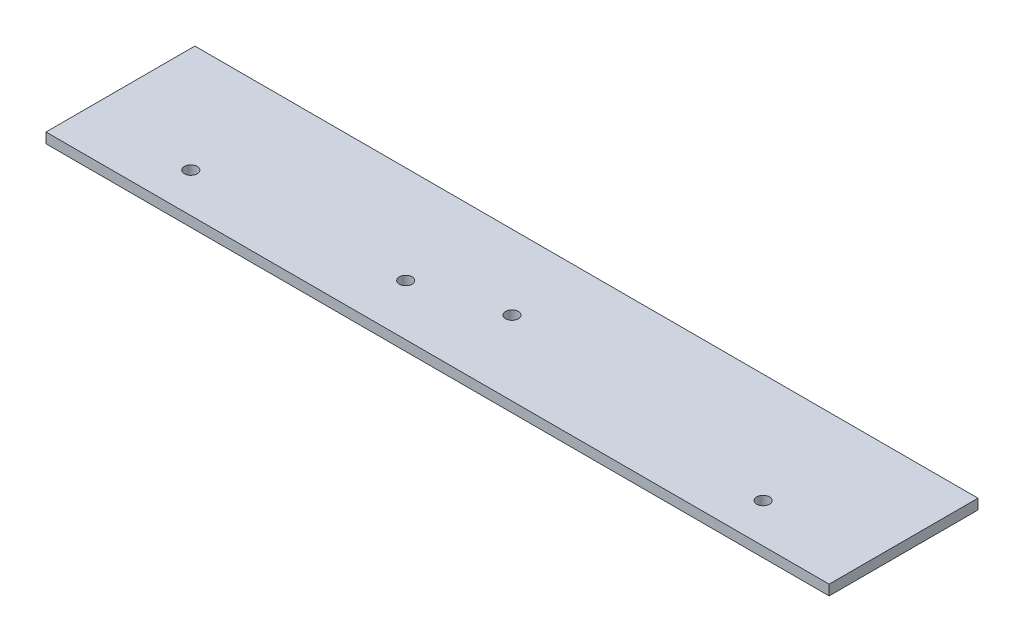
from build123d import *

# Parameters (mm, degrees)
SKETCH1_W           = 194.300874916
SKETCH1_H           = 36.931173376
SKETCH1_R           = 1.5875
BOSS_EXTRUDE1_DEPTH = 1.27


with BuildPart() as part:
    # Sketch1 → Boss-Extrude1 (new, symmetric)
    with BuildSketch(Plane(origin=(0, 0, 0), x_dir=(1, 0, 0), z_dir=(0, 1, 0))):
        Rectangle(SKETCH1_W, SKETCH1_H)
        with Locations((-71, -8.695)):
            Circle(SKETCH1_R, mode=Mode.SUBTRACT)
        with Locations((71, -8.695)):
            Circle(SKETCH1_R, mode=Mode.SUBTRACT)
        Circle(SKETCH1_R, mode=Mode.SUBTRACT)
        with Locations((-20.62, -5.75)):
            Circle(SKETCH1_R, mode=Mode.SUBTRACT)
    extrude(amount=BOSS_EXTRUDE1_DEPTH, both=True)


solid = part.part
